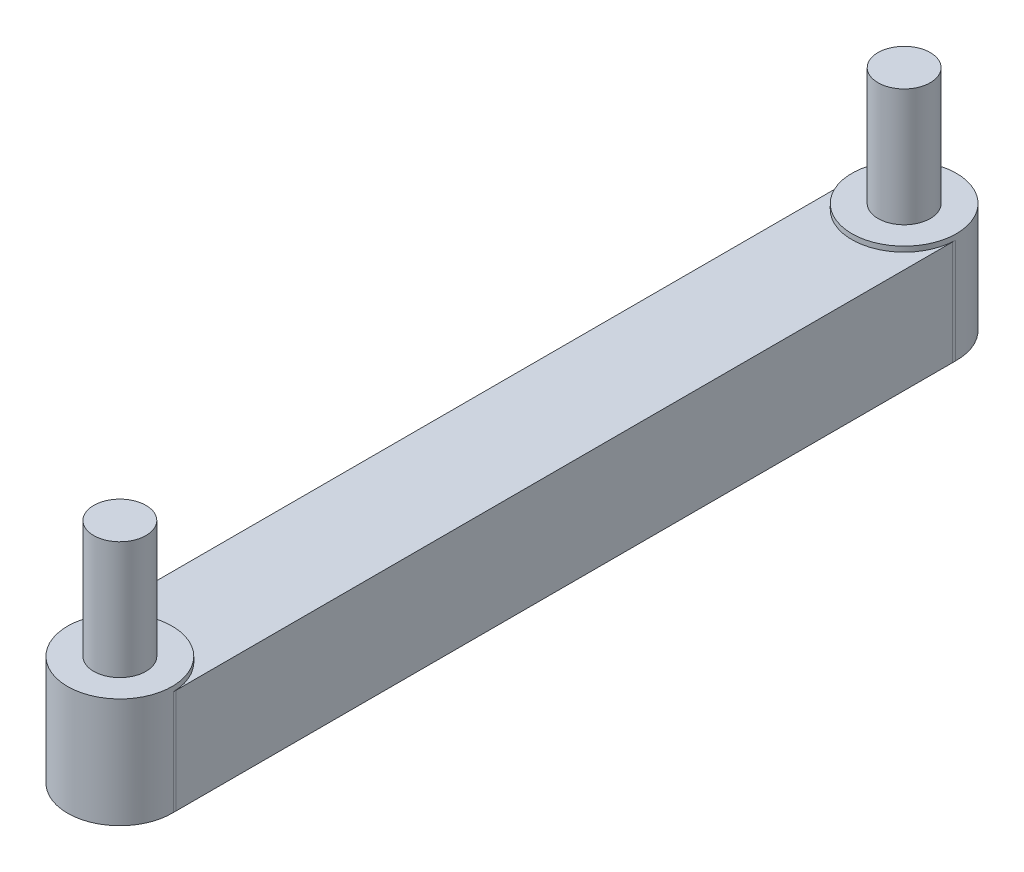
from build123d import *

# Parameters (mm, degrees)
SKIZZE1_W                            = 4
SKIZZE1_H                            = 4
AUFSATZ_LINEAR_AUSTRAGEN1_DEPTH      = 29.7
AUFSATZ_LINEAR_AUSTRAGEN2_DEPTH      = 0.2
AUFSATZ_LINEAR_AUSTRAGEN2_DEPTH_BACK = 4
AUFSATZ_LINEAR_AUSTRAGEN2_START      = 2
SKIZZE2_R                            = 2
SKIZZE3_R                            = 1
AUFSATZ_LINEAR_AUSTRAGEN4_DEPTH      = 4.5
VERRUNDUNG1_R                        = 2


with BuildPart() as part:
    # Skizze1 → Aufsatz-Linear austragen1 (new body)
    with BuildSketch(Plane.XY):
        Rectangle(SKIZZE1_W, SKIZZE1_H)
    extrude(amount=AUFSATZ_LINEAR_AUSTRAGEN1_DEPTH)

    # Skizze2 → Aufsatz-Linear austragen2 (add, two sides: drawn at the far end of the back side and taken through both)
    with BuildSketch(Plane(origin=(0, 0, 0), x_dir=(1, 0, 0), z_dir=(0, 1, 0)).offset(AUFSATZ_LINEAR_AUSTRAGEN2_START - AUFSATZ_LINEAR_AUSTRAGEN2_DEPTH_BACK)):
        with Locations(Location((0, -29.85, 0), (0, 0, 175.698777695))):
            Circle(SKIZZE2_R)
        with Locations(Location((0, 0.15, 0), (0, 0, 355.698777695))):
            Circle(SKIZZE2_R)
    extrude(amount=AUFSATZ_LINEAR_AUSTRAGEN2_DEPTH + AUFSATZ_LINEAR_AUSTRAGEN2_DEPTH_BACK)

    # Skizze3 → Aufsatz-Linear austragen4 (add)
    with BuildSketch(Plane(origin=(0, 2.2, 0), x_dir=(1, 0, 0), z_dir=(0, 1, 0))):
        with Locations(Location((0, -29.85, 0), (0, 0, 270))):
            Circle(SKIZZE3_R)
        with Locations(Location((0, 0.15, 0), (0, 0, 270))):
            Circle(SKIZZE3_R)
    extrude(amount=AUFSATZ_LINEAR_AUSTRAGEN4_DEPTH)

    # Verrundung1
    # the kernel refuses this fillet: 2 mm, written as the material it adds along each edge
    with BuildSketch(Plane(origin=(-1.994367068, 2, 29.7), x_dir=(-0.048500864171623644, 0, 0.9988231405882653), z_dir=(0, -1, 0)), Plane(origin=(1.994367068, 2, 0), x_dir=(0.04850086417162046, 0, -0.9988231405882655), z_dir=(0, -1, 0))) as verrundung1_piece_1:
        with BuildLine():
            CenterArc((0.159284835, 1.999295107), VERRUNDUNG1_R, 265.439839389, 3.038923762)
            Line((0.000273202, 0.005626303), (0, 0))
            ThreePointArc((0, 0), (0.053094945, 0.000704893), (0.10618989, 0))
        make_face()
    extrude(amount=4)
    with BuildSketch(Plane(origin=(1.994367068, -2, 29.7), x_dir=(1, 0, 0), z_dir=(0, 1, 0)), Plane(origin=(-1.994367068, -2, 0), x_dir=(-1, 0, 0), z_dir=(0, 1, 0))) as verrundung1_piece_2:
        with BuildLine():
            CenterArc((2.00466767, -0.062129838), VERRUNDUNG1_R, 178.219824845, 3.038923762)
            ThreePointArc((0.005150301, -0.106064919), (0.003279214, -0.052998272), (0, 0))
            Line((0, 0), (0.005632932, 0))
        make_face()
    extrude(amount=4)


solid = part.part
